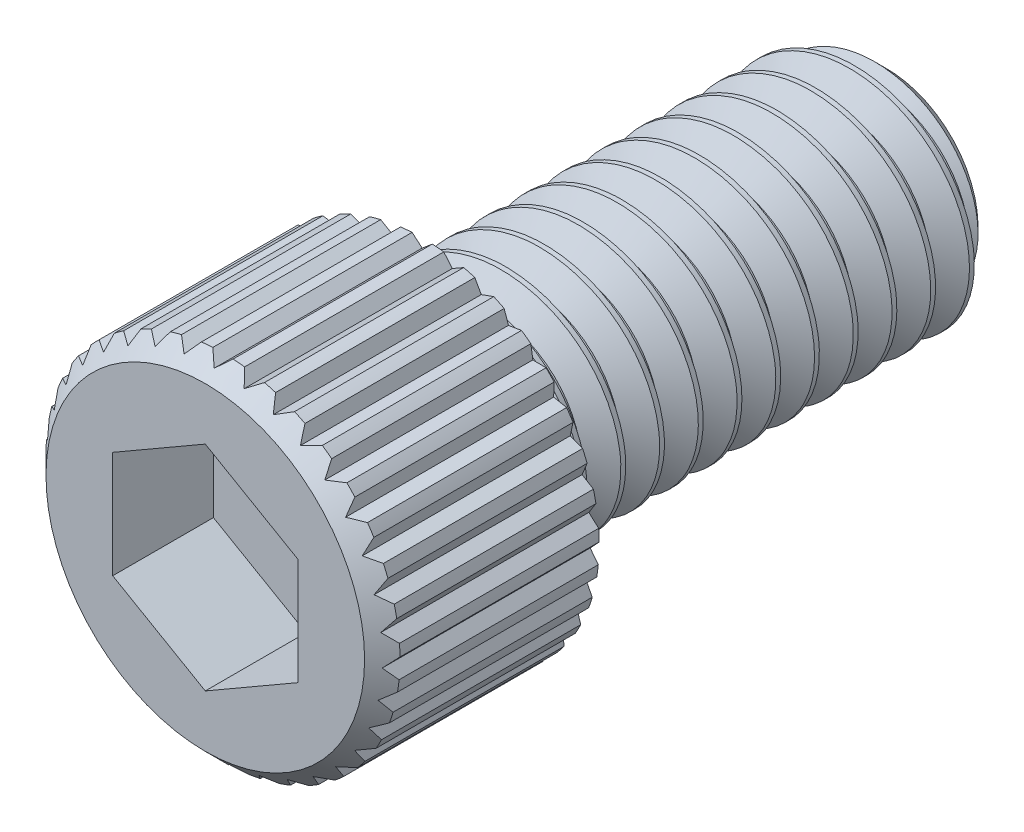
from build123d import *

# Parameters (mm, degrees)
CUT_EXTRUDE1_START = -1.3
CUT_EXTRUDE1_DEPTH = 1.3
CUT_SWEEP1_PITCH   = 0.5
CUT_EXTRUDE4_DEPTH = 10.374564084
CIRPATTERN1_COUNT  = 35


# Read off the part's stored shape, not the designer's step: Split1
with BuildPart() as part:
    # Sketch2 → Revolve1 (revolve)
    with BuildSketch(Plane(origin=(0, 0, 0), x_dir=(0, 0, -1), z_dir=(1, 0, 0)), mode=Mode.PRIVATE) as revolve1_sk:
        Polygon((-4.4, 1.195), (-3.1, 1.195), (-3.1, 0), (4.4, 0), (4.4, 1.175240474), (4.075240474, 1.5), (-1.6, 1.5), (-1.6, 2.285), (-4.1715, 2.285), (-4.4, 2.0565), align=None)
    revolve(revolve1_sk.sketch.rotate(Axis((0, 0, 4.4), (0, 0, -1)), 90), axis=Axis((0, 0, 4.4), (0, 0, -1)))

    # Sketch3 → Cut-Extrude1 (cut)
    with BuildSketch(Plane.XY.offset(4.4).offset(CUT_EXTRUDE1_START)):
        Polygon((0, 1.379867143), (-1.195, 0.689933572), (-1.195, -0.689933572), (0, -1.379867143), (1.195, -0.689933572), (1.195, 0.689933572), align=None)
    extrude(amount=CUT_EXTRUDE1_DEPTH, mode=Mode.SUBTRACT)


with BuildPart() as body_2:
    # Split1: the piece on the far side of the plane
    add(part.part)
    split(bisect_by=Plane.XY.offset(1.6), keep=Keep.BOTTOM)

    # Cut-Sweep1: the profile of Sketch7 screwed along a right-hand helix of 13 turns, 6 arcs to a turn; built about Z, then put on its axis
    cut_sweep1_z = Axis((0, 0, 0), (0, 0, 1))
    cut_sweep1_corners = [(1.527063294, 0, 0.015625), (1.527063294, 0, -0.453125), (1.175240474, 0, -0.25), (1.175240474, 0, -0.1875)]
    with BuildLine(mode=Mode.PRIVATE) as cut_sweep1_profile:
        Line(cut_sweep1_corners[0], cut_sweep1_corners[1])
        Line(cut_sweep1_corners[1], cut_sweep1_corners[2])
        Line(cut_sweep1_corners[2], cut_sweep1_corners[3])
        Line(cut_sweep1_corners[3], cut_sweep1_corners[0])
    cut_sweep1_cap = Face(cut_sweep1_profile.wire())
    cut_sweep1_turn_angles = [0, 30, 60, 90, 120, 150, 180, 210, 240, 270, 300, 330, 360]
    cut_sweep1_turn_weights = [1, 0.8660254037844387, 1, 0.8660254037844387, 1, 0.8660254037844387, 1, 0.8660254037844387, 1, 0.8660254037844387, 1, 0.8660254037844387, 1]
    cut_sweep1_turn_rails = [Edge.make_bspline([Vector(p[0], p[1], 0).rotate(cut_sweep1_z, cut_sweep1_turn_angles[k]) / cut_sweep1_turn_weights[k] + Vector(0, 0, p[2] + CUT_SWEEP1_PITCH * cut_sweep1_turn_angles[k] / 360) for k in range(13)], [0, 0, 0, 1, 1, 2, 2, 3, 3, 4, 4, 5, 5, 6, 6, 6], 2, cut_sweep1_turn_weights) for p in cut_sweep1_corners]
    cut_sweep1_turn_sides = [Face.make_surface_from_curves(cut_sweep1_turn_rails[p[0]], cut_sweep1_turn_rails[p[1]]) for p in [(0, 1), (1, 2), (2, 3), (3, 0)]]
    cut_sweep1 = Plane(origin=(0, 0, -4.4), x_dir=(0, 1, 0), z_dir=(0, 0, 1)) * Solid(Shell([*[p.moved(Location((0, 0, CUT_SWEEP1_PITCH * i))) for i in range(13) for p in cut_sweep1_turn_sides], cut_sweep1_cap, cut_sweep1_cap.rotate(cut_sweep1_z, 4680).moved(Location((0, 0, CUT_SWEEP1_PITCH * 4680 / 360)))]))
    add(cut_sweep1, mode=Mode.SUBTRACT)


with BuildPart() as part_1:
    add(part.part)

    # Split1
    split(bisect_by=Plane.XY.offset(1.6), keep=Keep.TOP)

    add(body_2.part)  # Boss-Extrude1 merges body 2
    # Boss-Extrude1 cone 1 section (through the dimple's axis) → Boss-Extrude1 (revolve)
    with BuildSketch(Plane(origin=(0, 0, 1.6), x_dir=(0, -1, 0), z_dir=(1, 0, 0))):
        Polygon((0, 0), (1.554126588, 0), (0, 1.554126588), align=None)
    revolve(axis=Axis((0, 0, 1.6), (0, 0, -1)))

    # Sketch9 → Cut-Extrude4 (cut, symmetric)
    with BuildSketch(Plane.XY.offset(4.4)):
        Polygon((0, 2.39925), (0.26963, 2.39925), (0, 2.17075), (-0.26963, 2.39925), align=None)
    cut_extrude4 = extrude(amount=CUT_EXTRUDE4_DEPTH, both=True, mode=Mode.SUBTRACT)

    # CirPattern1: Cut-Extrude4 ×35 about axis
    cirpattern1_axis = Axis((0, 0, 0), (0, 0, 1))
    for i in range(1, CIRPATTERN1_COUNT):
        add(cut_extrude4.rotate(cirpattern1_axis, i * 360 / CIRPATTERN1_COUNT), mode=Mode.SUBTRACT)


solid = part_1.part
